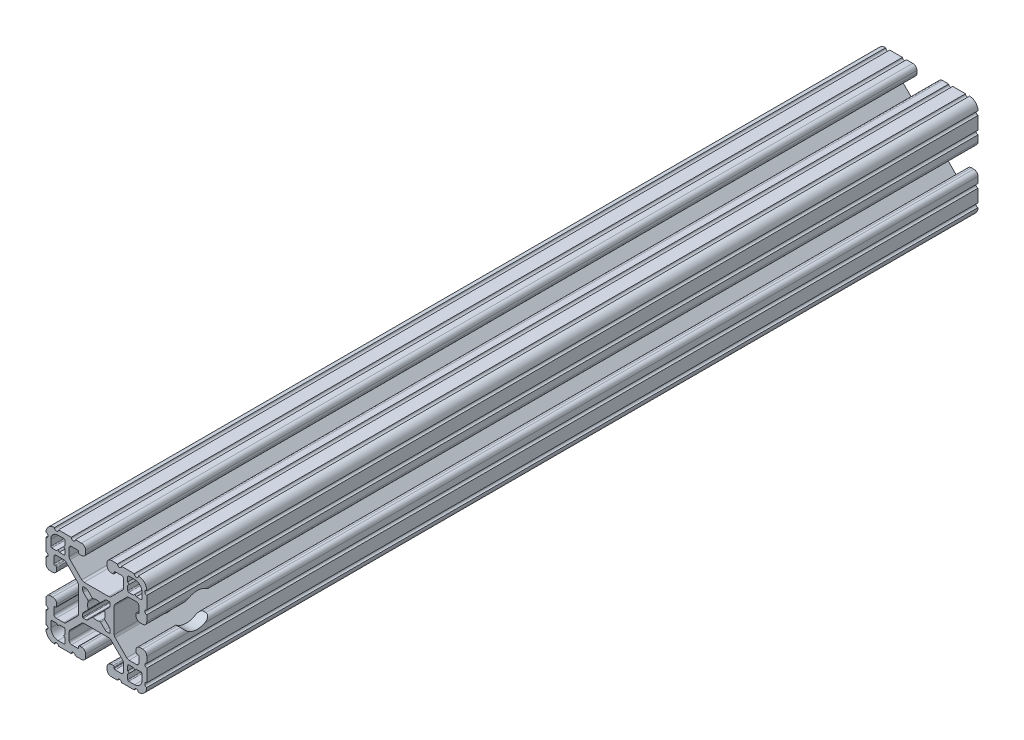
from build123d import *

# Parameters (mm, degrees)
BOSS_EXTRUDE1_DEPTH = 314.325
SKETCH2_R           = 6.35
CUT_EXTRUDE1_DEPTH  = 2323.966592157


with BuildPart() as part:
    # Sketch1 → Boss-Extrude1 (new body)
    with BuildSketch(Plane(origin=(0, 0, -2322.576), x_dir=(-1, 0, 0), z_dir=(0, 0, -1))):
        with BuildLine():
            Line((19.05, -14.325600033), (19.05, -9.4996))
            ThreePointArc((19.05, -9.4996), (18.288, -8.7376), (19.05, -7.9756))
            Line((19.05, -7.9756), (19.05, -5.6388))
            ThreePointArc((19.05, -5.6388), (18.588751759, -4.525248241), (17.4752, -4.064))
            Line((17.4752, -4.064), (16.5608, -4.064))
            ThreePointArc((16.5608, -4.064), (15.447248241, -4.525248241), (14.986, -5.6388))
            Line((14.986, -5.6388), (14.986, -6.350014224))
            ThreePointArc((14.986, -6.350014224), (15.097592316, -6.619421908), (15.367, -6.731014224))
            Line((15.367, -6.731014224), (15.6972, -6.731014224))
            ThreePointArc((15.6972, -6.731014224), (15.966607684, -6.84260654), (16.0782, -7.112014224))
            Line((16.0782, -7.112014224), (16.0782, -9.398014224))
            ThreePointArc((16.0782, -9.398014224), (15.817817928, -10.026632152), (15.1892, -10.287014224))
            Line((15.1892, -10.287014224), (12.375630013, -10.287014224))
            ThreePointArc((12.375630013, -10.287014224), (11.889622054, -10.19034123), (11.477604401, -9.915039836))
            Line((11.477604401, -9.915039836), (7.115699788, -5.553135223))
            ThreePointArc((7.115699788, -5.553135223), (6.840398394, -5.14111757), (6.7437254, -4.655109611))
            Line((6.7437254, -4.655109611), (6.7437254, 4.655109611))
            ThreePointArc((6.7437254, 4.655109611), (6.840398394, 5.14111757), (7.115699788, 5.553135223))
            Line((7.115699788, 5.553135223), (11.477604401, 9.915039836))
            ThreePointArc((11.477604401, 9.915039836), (11.889622054, 10.19034123), (12.375630013, 10.287014224))
            Line((12.375630013, 10.287014224), (15.1892, 10.287014224))
            ThreePointArc((15.1892, 10.287014224), (15.817817928, 10.026632152), (16.0782, 9.398014224))
            Line((16.0782, 9.398014224), (16.0782, 7.112014224))
            ThreePointArc((16.0782, 7.112014224), (15.966607684, 6.84260654), (15.6972, 6.731014224))
            Line((15.6972, 6.731014224), (15.367, 6.731014224))
            ThreePointArc((15.367, 6.731014224), (15.097592316, 6.619421908), (14.986, 6.350014224))
            Line((14.986, 6.350014224), (14.986, 5.6388))
            ThreePointArc((14.986, 5.6388), (15.447248241, 4.525248241), (16.5608, 4.064))
            Line((16.5608, 4.064), (17.4752, 4.064))
            ThreePointArc((17.4752, 4.064), (18.588751759, 4.525248241), (19.05, 5.6388))
            Line((19.05, 5.6388), (19.05, 7.9756))
            ThreePointArc((19.05, 7.9756), (18.288, 8.7376), (19.05, 9.4996))
            Line((19.05, 9.4996), (19.05, 14.325599984))
            ThreePointArc((19.05, 14.325599984), (18.287999986, 15.087549208), (19.049898416, 15.849600009))
            ThreePointArc((19.049898416, 15.849600009), (18.120064036, 18.120064058), (15.849599977, 19.049898414))
            ThreePointArc((15.849599977, 19.049898414), (15.0875492, 18.288000035), (14.325600017, 19.050000016))
            Line((14.325600017, 19.050000016), (9.499600001, 19.050000016))
            ThreePointArc((9.499600001, 19.050000016), (8.737600001, 18.288000016), (7.975600001, 19.050000016))
            Line((7.975600001, 19.050000016), (5.638800016, 19.050000016))
            ThreePointArc((5.638800016, 19.050000016), (4.525248257, 18.588751775), (4.064000016, 17.475200016))
            Line((4.064000016, 17.475200016), (4.064000016, 16.5608))
            ThreePointArc((4.064000016, 16.5608), (4.525248257, 15.447248241), (5.638800016, 14.986))
            Line((5.638800016, 14.986), (6.350014224, 14.986))
            ThreePointArc((6.350014224, 14.986), (6.619421908, 15.097592316), (6.731014224, 15.367))
            Line((6.731014224, 15.367), (6.731014224, 15.6972))
            ThreePointArc((6.731014224, 15.6972), (6.84260654, 15.966607684), (7.112014224, 16.0782))
            Line((7.112014224, 16.0782), (9.398014224, 16.0782))
            ThreePointArc((9.398014224, 16.0782), (10.026632152, 15.817817928), (10.287014224, 15.1892))
            Line((10.287014224, 15.1892), (10.287014224, 12.375630013))
            ThreePointArc((10.287014224, 12.375630013), (10.19034123, 11.889622054), (9.915039836, 11.477604401))
            Line((9.915039836, 11.477604401), (5.553135223, 7.115699788))
            ThreePointArc((5.553135223, 7.115699788), (5.14111757, 6.840398394), (4.655109611, 6.7437254))
            Line((4.655109611, 6.7437254), (-4.655109611, 6.7437254))
            ThreePointArc((-4.655109611, 6.7437254), (-5.14111757, 6.840398394), (-5.553135223, 7.115699788))
            Line((-5.553135223, 7.115699788), (-9.915039836, 11.477604401))
            ThreePointArc((-9.915039836, 11.477604401), (-10.19034123, 11.889622054), (-10.287014224, 12.375630013))
            Line((-10.287014224, 12.375630013), (-10.287014224, 15.1892))
            ThreePointArc((-10.287014224, 15.1892), (-10.026632152, 15.817817928), (-9.398014224, 16.0782))
            Line((-9.398014224, 16.0782), (-7.112014224, 16.0782))
            ThreePointArc((-7.112014224, 16.0782), (-6.84260654, 15.966607684), (-6.731014224, 15.6972))
            Line((-6.731014224, 15.6972), (-6.731014224, 15.367))
            ThreePointArc((-6.731014224, 15.367), (-6.619421908, 15.097592316), (-6.350014224, 14.986))
            Line((-6.350014224, 14.986), (-5.638799984, 14.986))
            ThreePointArc((-5.638799984, 14.986), (-4.525248225, 15.447248241), (-4.063999984, 16.5608))
            Line((-4.063999984, 16.5608), (-4.063999984, 17.475200016))
            ThreePointArc((-4.063999984, 17.475200016), (-4.525248225, 18.588751775), (-5.638799984, 19.050000016))
            Line((-5.638799984, 19.050000016), (-7.975599999, 19.050000016))
            ThreePointArc((-7.975599999, 19.050000016), (-8.737599999, 18.288000016), (-9.499599999, 19.050000016))
            Line((-9.499599999, 19.050000016), (-14.325599999, 19.050000016))
            ThreePointArc((-14.325599999, 19.050000016), (-15.087549199, 18.288000018), (-15.849599993, 19.049898416))
            ThreePointArc((-15.849599993, 19.049898416), (-18.120064042, 18.120064036), (-19.049898398, 15.849599976))
            ThreePointArc((-19.049898398, 15.849599976), (-18.288000019, 15.087549199), (-19.05, 14.325600017))
            Line((-19.05, 14.325600017), (-19.05, 9.4996))
            ThreePointArc((-19.05, 9.4996), (-18.288, 8.7376), (-19.05, 7.9756))
            Line((-19.05, 7.9756), (-19.05, 5.6388))
            ThreePointArc((-19.05, 5.6388), (-18.588751759, 4.525248241), (-17.4752, 4.064))
            Line((-17.4752, 4.064), (-16.5608, 4.064))
            ThreePointArc((-16.5608, 4.064), (-15.447248241, 4.525248241), (-14.986, 5.6388))
            Line((-14.986, 5.6388), (-14.986, 6.350014224))
            ThreePointArc((-14.986, 6.350014224), (-15.097592316, 6.619421908), (-15.367, 6.731014224))
            Line((-15.367, 6.731014224), (-15.6972, 6.731014224))
            ThreePointArc((-15.6972, 6.731014224), (-15.966607684, 6.84260654), (-16.0782, 7.112014224))
            Line((-16.0782, 7.112014224), (-16.0782, 9.398014224))
            ThreePointArc((-16.0782, 9.398014224), (-15.817817928, 10.026632152), (-15.1892, 10.287014224))
            Line((-15.1892, 10.287014224), (-12.375630013, 10.287014224))
            ThreePointArc((-12.375630013, 10.287014224), (-11.889622054, 10.19034123), (-11.477604401, 9.915039836))
            Line((-11.477604401, 9.915039836), (-7.115699788, 5.553135223))
            ThreePointArc((-7.115699788, 5.553135223), (-6.840398394, 5.14111757), (-6.7437254, 4.655109611))
            Line((-6.7437254, 4.655109611), (-6.7437254, -4.655109611))
            ThreePointArc((-6.7437254, -4.655109611), (-6.840398394, -5.14111757), (-7.115699788, -5.553135223))
            Line((-7.115699788, -5.553135223), (-11.477604401, -9.915039836))
            ThreePointArc((-11.477604401, -9.915039836), (-11.889622054, -10.19034123), (-12.375630013, -10.287014224))
            Line((-12.375630013, -10.287014224), (-15.1892, -10.287014224))
            ThreePointArc((-15.1892, -10.287014224), (-15.817817928, -10.026632152), (-16.0782, -9.398014224))
            Line((-16.0782, -9.398014224), (-16.0782, -7.112014224))
            ThreePointArc((-16.0782, -7.112014224), (-15.966607684, -6.84260654), (-15.6972, -6.731014224))
            Line((-15.6972, -6.731014224), (-15.367, -6.731014224))
            ThreePointArc((-15.367, -6.731014224), (-15.097592316, -6.619421908), (-14.986, -6.350014224))
            Line((-14.986, -6.350014224), (-14.986, -5.6388))
            ThreePointArc((-14.986, -5.6388), (-15.447248241, -4.525248241), (-16.5608, -4.064))
            Line((-16.5608, -4.064), (-17.4752, -4.064))
            ThreePointArc((-17.4752, -4.064), (-18.588751759, -4.525248241), (-19.05, -5.6388))
            Line((-19.05, -5.6388), (-19.05, -7.9756))
            ThreePointArc((-19.05, -7.9756), (-18.288, -8.7376), (-19.05, -9.4996))
            Line((-19.05, -9.4996), (-19.05, -14.3256))
            ThreePointArc((-19.05, -14.3256), (-18.288000002, -15.0875492), (-19.0498984, -15.849599993))
            ThreePointArc((-19.0498984, -15.849599993), (-18.120064019, -18.120064043), (-15.84959996, -19.049898399))
            ThreePointArc((-15.84959996, -19.049898399), (-15.087549183, -18.288000019), (-14.325600001, -19.050000001))
            Line((-14.325600001, -19.050000001), (-9.499599984, -19.050000001))
            ThreePointArc((-9.499599984, -19.050000001), (-8.737599984, -18.288000001), (-7.975599984, -19.050000001))
            Line((-7.975599984, -19.050000001), (-5.638799984, -19.050000001))
            ThreePointArc((-5.638799984, -19.050000001), (-4.525248225, -18.58875176), (-4.063999984, -17.475200001))
            Line((-4.063999984, -17.475200001), (-4.063999984, -16.5608))
            ThreePointArc((-4.063999984, -16.5608), (-4.525248225, -15.447248241), (-5.638799984, -14.986))
            Line((-5.638799984, -14.986), (-6.350014224, -14.986))
            ThreePointArc((-6.350014224, -14.986), (-6.619421908, -15.097592316), (-6.731014224, -15.367))
            Line((-6.731014224, -15.367), (-6.731014224, -15.6972))
            ThreePointArc((-6.731014224, -15.6972), (-6.84260654, -15.966607684), (-7.112014224, -16.0782))
            Line((-7.112014224, -16.0782), (-9.398014224, -16.0782))
            ThreePointArc((-9.398014224, -16.0782), (-10.026632152, -15.817817928), (-10.287014224, -15.1892))
            Line((-10.287014224, -15.1892), (-10.287014224, -12.375630013))
            ThreePointArc((-10.287014224, -12.375630013), (-10.19034123, -11.889622054), (-9.915039836, -11.477604401))
            Line((-9.915039836, -11.477604401), (-5.553135223, -7.115699788))
            ThreePointArc((-5.553135223, -7.115699788), (-5.14111757, -6.840398394), (-4.655109611, -6.7437254))
            Line((-4.655109611, -6.7437254), (4.655109611, -6.7437254))
            ThreePointArc((4.655109611, -6.7437254), (5.14111757, -6.840398394), (5.553135223, -7.115699788))
            Line((5.553135223, -7.115699788), (9.915039836, -11.477604401))
            ThreePointArc((9.915039836, -11.477604401), (10.19034123, -11.889622054), (10.287014224, -12.375630013))
            Line((10.287014224, -12.375630013), (10.287014224, -15.1892))
            ThreePointArc((10.287014224, -15.1892), (10.026632152, -15.817817928), (9.398014224, -16.0782))
            Line((9.398014224, -16.0782), (7.112014224, -16.0782))
            ThreePointArc((7.112014224, -16.0782), (6.84260654, -15.966607684), (6.731014224, -15.6972))
            Line((6.731014224, -15.6972), (6.731014224, -15.367))
            ThreePointArc((6.731014224, -15.367), (6.619421908, -15.097592316), (6.350014224, -14.986))
            Line((6.350014224, -14.986), (5.638800016, -14.986))
            ThreePointArc((5.638800016, -14.986), (4.525248257, -15.447248241), (4.064000016, -16.5608))
            Line((4.064000016, -16.5608), (4.064000016, -17.475200001))
            ThreePointArc((4.064000016, -17.475200001), (4.525248257, -18.58875176), (5.638800016, -19.050000001))
            Line((5.638800016, -19.050000001), (7.975600016, -19.050000001))
            ThreePointArc((7.975600016, -19.050000001), (8.737600016, -18.288000001), (9.499600016, -19.050000001))
            Line((9.499600016, -19.050000001), (14.325600016, -19.050000001))
            ThreePointArc((14.325600016, -19.050000001), (15.087549216, -18.288000002), (15.849600009, -19.0498984))
            ThreePointArc((15.849600009, -19.0498984), (18.120064059, -18.12006402), (19.049898415, -15.849599961))
            ThreePointArc((19.049898415, -15.849599961), (18.288000034, -15.087549207), (19.05, -14.325600033))
        make_face()
        with BuildLine():
            Line((17.246614224, 14.452614224), (17.246614224, 12.242814224))
            ThreePointArc((17.246614224, 12.242814224), (17.135021908, 11.97340654), (16.865614224, 11.861814224))
            Line((16.865614224, 11.861814224), (15.092694224, 11.861814224))
            Line((15.092694224, 11.861814224), (14.554214224, 12.400294224))
            Line((14.554214224, 12.400294224), (14.015734224, 11.861814224))
            Line((14.015734224, 11.861814224), (12.242814224, 11.861814224))
            ThreePointArc((12.242814224, 11.861814224), (11.97340654, 11.97340654), (11.861814224, 12.242814224))
            Line((11.861814224, 12.242814224), (11.861814224, 14.015734224))
            Line((11.861814224, 14.015734224), (12.400294224, 14.554214224))
            Line((12.400294224, 14.554214224), (11.861814224, 15.092694224))
            Line((11.861814224, 15.092694224), (11.861814224, 16.865614224))
            ThreePointArc((11.861814224, 16.865614224), (11.97340654, 17.135021908), (12.242814224, 17.246614224))
            Line((12.242814224, 17.246614224), (14.452614224, 17.246614224))
            ThreePointArc((14.452614224, 17.246614224), (16.428270571, 16.428270571), (17.246614224, 14.452614224))
        make_face(mode=Mode.SUBTRACT)
        with BuildLine():
            Line((17.246614224, -12.242814224), (17.246614224, -14.452614224))
            ThreePointArc((17.246614224, -14.452614224), (16.428270571, -16.428270571), (14.452614224, -17.246614224))
            Line((14.452614224, -17.246614224), (12.242814224, -17.246614224))
            ThreePointArc((12.242814224, -17.246614224), (11.97340654, -17.135021908), (11.861814224, -16.865614224))
            Line((11.861814224, -16.865614224), (11.861814224, -15.092694224))
            Line((11.861814224, -15.092694224), (12.400294224, -14.554214224))
            Line((12.400294224, -14.554214224), (11.861814224, -14.015734224))
            Line((11.861814224, -14.015734224), (11.861814224, -12.242814224))
            ThreePointArc((11.861814224, -12.242814224), (11.97340654, -11.97340654), (12.242814224, -11.861814224))
            Line((12.242814224, -11.861814224), (14.015734224, -11.861814224))
            Line((14.015734224, -11.861814224), (14.554214224, -12.400294224))
            Line((14.554214224, -12.400294224), (15.092694224, -11.861814224))
            Line((15.092694224, -11.861814224), (16.865614224, -11.861814224))
            ThreePointArc((16.865614224, -11.861814224), (17.135021908, -11.97340654), (17.246614224, -12.242814224))
        make_face(mode=Mode.SUBTRACT)
        with BuildLine():
            Line((5.1689, -3.920689755), (5.1689, -4.9149))
            ThreePointArc((5.1689, -4.9149), (5.094505122, -5.094505122), (4.9149, -5.1689))
            Line((4.9149, -5.1689), (3.920689755, -5.1689))
            ThreePointArc((3.920689755, -5.1689), (3.580484184, -5.101228904), (3.292071827, -4.908517928))
            Line((3.292071827, -4.908517928), (1.582347442, -3.198793543))
            ThreePointArc((1.582347442, -3.198793543), (1.393016011, -3.095711236), (1.178048687, -3.111879183))
            ThreePointArc((1.178048687, -3.111879183), (0, -3.3274), (-1.178048687, -3.111879183))
            ThreePointArc((-1.178048687, -3.111879183), (-1.393016011, -3.095711236), (-1.582347442, -3.198793543))
            Line((-1.582347442, -3.198793543), (-3.292071827, -4.908517928))
            ThreePointArc((-3.292071827, -4.908517928), (-3.580484184, -5.101228904), (-3.920689755, -5.1689))
            Line((-3.920689755, -5.1689), (-4.9149, -5.1689))
            ThreePointArc((-4.9149, -5.1689), (-5.094505122, -5.094505122), (-5.1689, -4.9149))
            Line((-5.1689, -4.9149), (-5.1689, -3.920689755))
            ThreePointArc((-5.1689, -3.920689755), (-5.101228904, -3.580484184), (-4.908517928, -3.292071827))
            Line((-4.908517928, -3.292071827), (-3.198793543, -1.582347442))
            ThreePointArc((-3.198793543, -1.582347442), (-3.095711236, -1.393016011), (-3.111879183, -1.178048687))
            ThreePointArc((-3.111879183, -1.178048687), (-3.3274, 0), (-3.111879183, 1.178048687))
            ThreePointArc((-3.111879183, 1.178048687), (-3.095711236, 1.393016011), (-3.198793543, 1.582347442))
            Line((-3.198793543, 1.582347442), (-4.908517928, 3.292071827))
            ThreePointArc((-4.908517928, 3.292071827), (-5.101228904, 3.580484184), (-5.1689, 3.920689755))
            Line((-5.1689, 3.920689755), (-5.1689, 4.9149))
            ThreePointArc((-5.1689, 4.9149), (-5.094505122, 5.094505122), (-4.9149, 5.1689))
            Line((-4.9149, 5.1689), (-3.920689755, 5.1689))
            ThreePointArc((-3.920689755, 5.1689), (-3.580484184, 5.101228904), (-3.292071827, 4.908517928))
            Line((-3.292071827, 4.908517928), (-1.582347442, 3.198793543))
            ThreePointArc((-1.582347442, 3.198793543), (-1.393016011, 3.095711236), (-1.178048687, 3.111879183))
            ThreePointArc((-1.178048687, 3.111879183), (0, 3.3274), (1.178048687, 3.111879183))
            ThreePointArc((1.178048687, 3.111879183), (1.393016011, 3.095711236), (1.582347442, 3.198793543))
            Line((1.582347442, 3.198793543), (3.292071827, 4.908517928))
            ThreePointArc((3.292071827, 4.908517928), (3.580484184, 5.101228904), (3.920689755, 5.1689))
            Line((3.920689755, 5.1689), (4.9149, 5.1689))
            ThreePointArc((4.9149, 5.1689), (5.094505122, 5.094505122), (5.1689, 4.9149))
            Line((5.1689, 4.9149), (5.1689, 3.920689755))
            ThreePointArc((5.1689, 3.920689755), (5.101228904, 3.580484184), (4.908517928, 3.292071827))
            Line((4.908517928, 3.292071827), (3.198793543, 1.582347442))
            ThreePointArc((3.198793543, 1.582347442), (3.095711236, 1.393016011), (3.111879183, 1.178048687))
            ThreePointArc((3.111879183, 1.178048687), (3.3274, 0), (3.111879183, -1.178048687))
            ThreePointArc((3.111879183, -1.178048687), (3.095711236, -1.393016011), (3.198793543, -1.582347442))
            Line((3.198793543, -1.582347442), (4.908517928, -3.292071827))
            ThreePointArc((4.908517928, -3.292071827), (5.101228904, -3.580484184), (5.1689, -3.920689755))
        make_face(mode=Mode.SUBTRACT)
        with BuildLine():
            Line((-11.861814224, -12.242814224), (-11.861814224, -14.015734224))
            Line((-11.861814224, -14.015734224), (-12.400294224, -14.554214224))
            Line((-12.400294224, -14.554214224), (-11.861814224, -15.092694224))
            Line((-11.861814224, -15.092694224), (-11.861814224, -16.865614224))
            ThreePointArc((-11.861814224, -16.865614224), (-11.97340654, -17.135021908), (-12.242814224, -17.246614224))
            Line((-12.242814224, -17.246614224), (-14.452614224, -17.246614224))
            ThreePointArc((-14.452614224, -17.246614224), (-16.428270571, -16.428270571), (-17.246614224, -14.452614224))
            Line((-17.246614224, -14.452614224), (-17.246614224, -12.242814224))
            ThreePointArc((-17.246614224, -12.242814224), (-17.135021908, -11.97340654), (-16.865614224, -11.861814224))
            Line((-16.865614224, -11.861814224), (-15.092694224, -11.861814224))
            Line((-15.092694224, -11.861814224), (-14.554214224, -12.400294224))
            Line((-14.554214224, -12.400294224), (-14.015734224, -11.861814224))
            Line((-14.015734224, -11.861814224), (-12.242814224, -11.861814224))
            ThreePointArc((-12.242814224, -11.861814224), (-11.97340654, -11.97340654), (-11.861814224, -12.242814224))
        make_face(mode=Mode.SUBTRACT)
        with BuildLine():
            Line((-11.861814224, 16.865614224), (-11.861814224, 15.092694224))
            Line((-11.861814224, 15.092694224), (-12.400294224, 14.554214224))
            Line((-12.400294224, 14.554214224), (-11.861814224, 14.015734224))
            Line((-11.861814224, 14.015734224), (-11.861814224, 12.242814224))
            ThreePointArc((-11.861814224, 12.242814224), (-11.97340654, 11.97340654), (-12.242814224, 11.861814224))
            Line((-12.242814224, 11.861814224), (-14.015734224, 11.861814224))
            Line((-14.015734224, 11.861814224), (-14.554214224, 12.400294224))
            Line((-14.554214224, 12.400294224), (-15.092694224, 11.861814224))
            Line((-15.092694224, 11.861814224), (-16.865614224, 11.861814224))
            ThreePointArc((-16.865614224, 11.861814224), (-17.135021908, 11.97340654), (-17.246614224, 12.242814224))
            Line((-17.246614224, 12.242814224), (-17.246614224, 14.452614224))
            ThreePointArc((-17.246614224, 14.452614224), (-16.428270571, 16.428270571), (-14.452614224, 17.246614224))
            Line((-14.452614224, 17.246614224), (-12.242814224, 17.246614224))
            ThreePointArc((-12.242814224, 17.246614224), (-11.97340654, 17.135021908), (-11.861814224, 16.865614224))
        make_face(mode=Mode.SUBTRACT)
    extrude(amount=-BOSS_EXTRUDE1_DEPTH)

    # Sketch2 → Cut-Extrude1 (cut, through all)
    with BuildSketch(Plane(origin=(19.05, 0, 0), x_dir=(0, 0, -1), z_dir=(1, 0, 0))):
        with Locations((2027.301, 0)):
            Circle(SKETCH2_R)
    extrude(amount=-CUT_EXTRUDE1_DEPTH, mode=Mode.SUBTRACT)


solid = part.part
